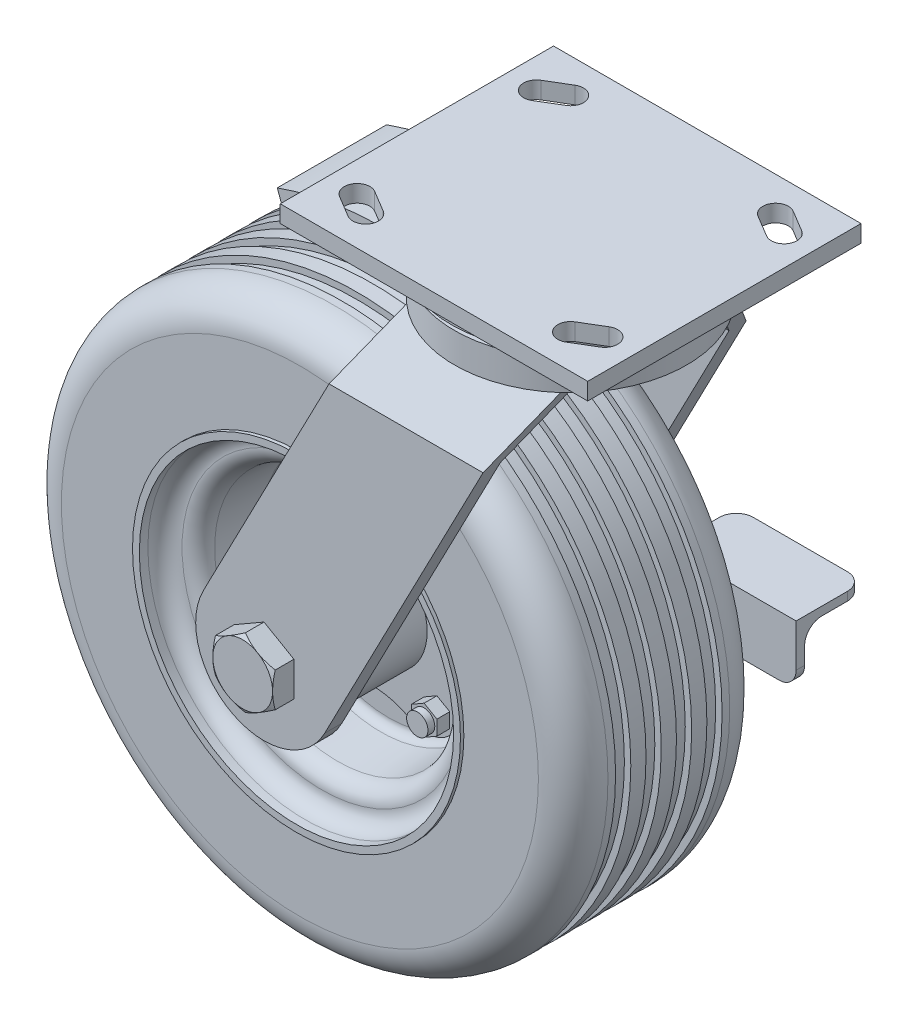
from build123d import *

# Parameters (mm, degrees)
SKETCH1_W               = 114.29999999999998
SKETCH1_H               = 6.349999999999999
BOSS_EXTRUDE1_DEPTH     = 50.8
F_1_2_HOLES_DEPTH       = 77.72734193232553
BOSS_EXTRUDE5_DEPTH     = 6.35
BOSS_EXTRUDE6_DEPTH     = 4.7625
SKETCH15_R              = 3.96874999999999
BOSS_EXTRUDE7_DEPTH     = 2.54
SKETCH16_R              = 6.3500000000000005
SKETCH16_R_2            = 6.349999999999994
BOSS_EXTRUDE8_DEPTH     = 4.7625
SKETCH7_W               = 195.3125047775847
SKETCH7_H               = 97.78999999999996
BOSS_EXTRUDE2_DEPTH     = 226.8474
CUT_EXTRUDE1_START      = -97.79
CUT_EXTRUDE1_DEPTH      = 97.79
CUT_EXTRUDE3_DEPTH      = 227.2515955736278
CUT_EXTRUDE3_DEPTH_BACK = 227.2515955736278
SKETCH9_OUTSIDE_W       = 174.294
SKETCH9_OUTSIDE_H       = 326.69399999999996
BOSS_EXTRUDE3_DEPTH     = 7.9375
SKETCH11_OUTSIDE_W      = 1416.8760000000002
SKETCH11_OUTSIDE_H      = 1447.038
SKETCH11_OUTSIDE_R      = 11.112499999999976
CUT_EXTRUDE4_DEPTH      = 323.3127017548331
CUT_EXTRUDE4_DRAFT      = -60.000000000000135
SKETCH12_R              = 10.794999999999998
BOSS_EXTRUDE4_DEPTH     = 85.09
BOSS_EXTRUDE9_DEPTH     = 3.175
BOSS_EXTRUDE10_DEPTH    = 53.33999999999999
FILLET1_R               = 12.7
FILLET2_R               = 15.875
BOSS_EXTRUDE11_DEPTH    = 40.64
BOSS_EXTRUDE12_DEPTH    = 3.175
SKETCH22_W              = 47.625
SKETCH22_H              = 3.1750000000000114
BOSS_EXTRUDE13_DEPTH    = 22.224999999999998
FILLET3_R               = 6.35
FILLET4_R               = 6.35
BOSS_EXTRUDE14_DEPTH    = 7.619999999999999


# Read off the part's stored shape, not the designer's step: Cut-Extrude1
with BuildPart() as part:
    # Sketch1 → Boss-Extrude1 (new, symmetric)
    with BuildSketch(Plane.XY):
        with Locations((0, -3.1749999999999994)):
            Rectangle(SKETCH1_W, SKETCH1_H)
    extrude(amount=BOSS_EXTRUDE1_DEPTH, both=True)

    # Sketch2 → 1-2 holes (cut, through all)
    with BuildSketch(Plane(origin=(0, 0, 0), x_dir=(1, 0, 0), z_dir=(0, 1, 0))):
        with BuildLine():
            Line((-35.6497139647764, 34.016189941294016), (-43.587213964776424, 29.253689941294038))
            ThreePointArc((-43.587213964776424, 29.253689941294038), (-50.12131005870599, 30.887213964776407), (-48.48778603522359, 37.421310058705984))
            Line((-48.48778603522359, 37.421310058705984), (-40.55028603522361, 42.18381005870601))
            ThreePointArc((-40.55028603522361, 42.18381005870601), (-34.016189941294016, 40.550286035223586), (-35.6497139647764, 34.016189941294016))
        make_face()
        with BuildLine():
            Line((-35.6497139647764, -34.016189941294016), (-43.587213964776424, -29.253689941294038))
            ThreePointArc((-43.587213964776424, -29.253689941294038), (-50.12131005870599, -30.887213964776407), (-48.48778603522359, -37.421310058705984))
            Line((-48.48778603522359, -37.421310058705984), (-40.55028603522361, -42.18381005870601))
            ThreePointArc((-40.55028603522361, -42.18381005870601), (-34.016189941294016, -40.550286035223586), (-35.6497139647764, -34.016189941294016))
        make_face()
        with BuildLine():
            Line((35.6497139647764, 34.016189941294016), (43.587213964776424, 29.253689941294038))
            ThreePointArc((43.587213964776424, 29.253689941294038), (50.12131005870599, 30.887213964776407), (48.48778603522359, 37.421310058705984))
            Line((48.48778603522359, 37.421310058705984), (40.55028603522361, 42.18381005870601))
            ThreePointArc((40.55028603522361, 42.18381005870601), (34.016189941294016, 40.550286035223586), (35.6497139647764, 34.016189941294016))
        make_face()
        with BuildLine():
            Line((35.6497139647764, -34.016189941294016), (43.587213964776424, -29.253689941294038))
            ThreePointArc((43.587213964776424, -29.253689941294038), (50.12131005870599, -30.887213964776407), (48.48778603522359, -37.421310058705984))
            Line((48.48778603522359, -37.421310058705984), (40.55028603522361, -42.18381005870601))
            ThreePointArc((40.55028603522361, -42.18381005870601), (34.016189941294016, -40.550286035223586), (35.6497139647764, -34.016189941294016))
        make_face()
    extrude(amount=-F_1_2_HOLES_DEPTH, mode=Mode.SUBTRACT)


with BuildPart() as body_2:
    # Sketch4 → Revolve1 (revolve)
    with BuildSketch(Plane.XY, mode=Mode.PRIVATE) as revolve1_sk:
        Polygon((2.55e-15, -27.1526), (43.17999999999999, -27.152599999999993), (43.17999999999999, -16.040099999999995), (40.64, -16.0401), (40.64, -13.5001), (44.449999999999996, -13.5001), (44.449999999999996, -6.35), (0, -6.350000000000005), align=None)
    revolve(revolve1_sk.sketch.rotate(Axis((0, -6.350000000000005, 0), (1.2e-16, -1, 0)), 180), axis=Axis((0, -6.350000000000005, 0), (1.2e-16, -1, 0)))


with BuildPart() as body_3:
    # Sketch6 → Revolve2 (revolve)
    with BuildSketch(Plane(origin=(-65.08749999999996, 0, 0), x_dir=(0, 0, -1), z_dir=(1, 0, 0)), mode=Mode.PRIVATE) as revolve2_sk:
        with BuildLine():
            Line((-35.559999999999995, -91.44000000000003), (-35.559999999999995, -63.7309090909091))
            ThreePointArc((-35.559999999999995, -63.7309090909091), (-31.772624414179496, -54.58737558582051), (-22.629090909090905, -50.80000000000001))
            Line((-22.629090909090905, -50.80000000000001), (-19.80045454545454, -50.80000000000001))
            Line((-19.80045454545454, -50.80000000000001), (-19.80045454545454, -53.18125000000001))
            Line((-19.80045454545454, -53.18125000000001), (-14.143181818181809, -53.18125000000001))
            Line((-14.143181818181809, -53.18125000000001), (-14.143181818181809, -50.80000000000001))
            Line((-14.143181818181809, -50.80000000000001), (-8.485909090909075, -50.80000000000001))
            Line((-8.485909090909075, -50.80000000000001), (-8.485909090909075, -53.18125000000001))
            Line((-8.485909090909075, -53.18125000000001), (-2.828636363636346, -53.18125000000001))
            Line((-2.828636363636346, -53.18125000000001), (-2.828636363636346, -50.80000000000001))
            Line((-2.828636363636346, -50.80000000000001), (2.828636363636346, -50.80000000000001))
            Line((2.828636363636346, -50.80000000000001), (2.8286363636363467, -53.18125000000001))
            Line((2.8286363636363467, -53.18125000000001), (8.485909090909075, -53.18125000000001))
            Line((8.485909090909075, -53.18125000000001), (8.485909090909075, -50.80000000000001))
            Line((8.485909090909075, -50.80000000000001), (14.143181818181809, -50.80000000000001))
            Line((14.143181818181809, -50.80000000000001), (14.143181818181809, -53.18125000000001))
            Line((14.143181818181809, -53.18125000000001), (19.80045454545454, -53.181250000000006))
            Line((19.80045454545454, -53.181250000000006), (19.80045454545454, -50.800000000000004))
            Line((19.80045454545454, -50.800000000000004), (22.629090909090905, -50.800000000000004))
            ThreePointArc((22.629090909090905, -50.800000000000004), (31.772624414179504, -54.587375585820496), (35.559999999999995, -63.73090909090909))
            Line((35.559999999999995, -63.73090909090909), (35.56000000000001, -91.44000000000001))
            Line((35.56000000000001, -91.44000000000001), (36.830000000000005, -91.44))
            Line((36.830000000000005, -91.44), (36.830000000000005, -93.97999999999999))
            Line((36.830000000000005, -93.97999999999999), (33.65500000000001, -93.97999999999999))
            ThreePointArc((33.65500000000001, -93.97999999999999), (29.16487193946543, -95.83987193946541), (27.305000000000017, -100.33))
            ThreePointArc((27.305000000000017, -100.33), (25.636711088744306, -104.61999781835944), (21.50843896644765, -106.6558363328826))
            Line((21.50843896644765, -106.6558363328826), (5.438280516776193, -108.06179301829418))
            ThreePointArc((5.438280516776193, -108.06179301829418), (3.374144455627869, -109.07971227555575), (2.5400000000000085, -111.22471118473547))
            Line((2.5400000000000085, -111.22471118473547), (2.540000000000014, -131.76250000000002))
            Line((2.540000000000014, -131.76250000000002), (36.83, -131.76250000000002))
            Line((36.83, -131.76250000000002), (40.004999999999995, -131.76250000000002))
            Line((40.004999999999995, -131.76250000000002), (40.00500000000001, -152.4))
            Line((40.00500000000001, -152.4), (-40.00499999999999, -152.4))
            Line((-40.00499999999999, -152.4), (-40.00499999999999, -131.76250000000002))
            Line((-40.00499999999999, -131.76250000000002), (-36.82999999999999, -131.76250000000002))
            Line((-36.82999999999999, -131.76250000000002), (-2.539999999999994, -131.76250000000002))
            Line((-2.539999999999994, -131.76250000000002), (-2.539999999999993, -111.22471118473547))
            ThreePointArc((-2.539999999999993, -111.22471118473547), (-3.374144455627854, -109.07971227555575), (-5.438280516776179, -108.06179301829418))
            Line((-5.438280516776179, -108.06179301829418), (-21.508438966447635, -106.6558363328826))
            ThreePointArc((-21.508438966447635, -106.6558363328826), (-25.636711088744292, -104.61999781835944), (-27.305000000000003, -100.33))
            ThreePointArc((-27.305000000000003, -100.33), (-29.16487193946542, -95.83987193946543), (-33.654999999999994, -93.98))
            Line((-33.654999999999994, -93.98), (-36.82999999999999, -93.98))
            Line((-36.82999999999999, -93.98), (-36.82999999999999, -91.44000000000001))
            Line((-36.82999999999999, -91.44000000000001), (-35.559999999999995, -91.44000000000003))
        make_face()
    revolve(revolve2_sk.sketch.rotate(Axis((-65.08749999999996, -152.4, 111.1453036524262), (0, 0, -1)), 90), axis=Axis((-65.08749999999996, -152.4, 111.1453036524262), (0, 0, -1)))

    # Sketch13 → Boss-Extrude5 (add)
    with BuildSketch(Plane.XY.offset(2.5399999999999934)):
        with BuildLine():
            ThreePointArc((-96.27931340691063, -138.06208940710718), (-94.20282593858815, -123.28467406141192), (-79.42541059289287, -121.20818659308935))
            ThreePointArc((-79.42541059289287, -121.20818659308935), (-65.08749999999998, -124.91657039491182), (-50.74958940710708, -121.20818659308935))
            ThreePointArc((-50.74958940710708, -121.20818659308935), (-35.97217406141179, -123.28467406141188), (-33.89568659308932, -138.06208940710718))
            ThreePointArc((-33.89568659308932, -138.06208940710718), (-37.60407039491186, -152.4), (-33.89568659308932, -166.73791059289283))
            ThreePointArc((-33.89568659308932, -166.73791059289283), (-35.97217406141181, -181.51532593858815), (-50.74958940710708, -183.59181340691066))
            ThreePointArc((-50.74958940710708, -183.59181340691066), (-65.08749999999999, -179.88342960508822), (-79.42541059289287, -183.5918134069107))
            ThreePointArc((-79.42541059289287, -183.5918134069107), (-94.20282593858819, -181.51532593858812), (-96.27931340691063, -166.7379105928928))
            ThreePointArc((-96.27931340691063, -166.7379105928928), (-92.57092960508812, -152.4), (-96.27931340691063, -138.06208940710718))
        make_face()
    extrude(amount=BOSS_EXTRUDE5_DEPTH)

    # Sketch14 → Boss-Extrude6 (add)
    with BuildSketch(Plane.XY.offset(8.889999999999993)):
        Polygon((-89.36202269130455, -133.62473862272662), (-84.59952269130454, -130.87510796571104), (-84.59952269130454, -125.37584665167986), (-89.3620226913045, -122.62621599466434), (-94.12452269130449, -125.3758466516799), (-94.12452269130449, -130.87510796571104), align=None)
        Polygon((-36.05047730869544, -130.87510796571104), (-40.81297730869539, -133.62473862272662), (-45.57547730869539, -130.87510796571104), (-45.57547730869539, -125.37584665167986), (-40.81297730869543, -122.62621599466434), (-36.05047730869544, -125.3758466516799), align=None)
        Polygon((-40.81297730869539, -171.17526137727342), (-45.57547730869539, -173.92489203428897), (-45.57547730869539, -179.42415334832015), (-40.81297730869543, -182.17378400533568), (-36.05047730869544, -179.42415334832012), (-36.05047730869544, -173.92489203428897), align=None)
        Polygon((-94.12452269130449, -173.92489203428897), (-89.36202269130455, -171.17526137727342), (-84.59952269130454, -173.92489203428897), (-84.59952269130454, -179.42415334832015), (-89.3620226913045, -182.17378400533568), (-94.12452269130449, -179.42415334832012), align=None)
    extrude(amount=BOSS_EXTRUDE6_DEPTH)

    # Sketch15 → Boss-Extrude7 (add)
    with BuildSketch(Plane.XY.offset(13.652499999999995)):
        with Locations((-89.3620226913045, -128.12547730869545)):
            Circle(SKETCH15_R)
        with Locations(Location((-40.81297730869543, -128.12547730869545, 0), (0, 0, 180))):
            Circle(SKETCH15_R)
        with Locations(Location((-89.3620226913045, -176.67452269130456, 0), (0, 0, 180))):
            Circle(SKETCH15_R)
        with Locations((-40.81297730869543, -176.67452269130456)):
            Circle(SKETCH15_R)
    extrude(amount=BOSS_EXTRUDE7_DEPTH)

    # Sketch16 → Boss-Extrude8 (add)
    with BuildSketch(Plane(origin=(0, 0, -2.5400000000000116), x_dir=(-1, 0, 0), z_dir=(0, 0, -1))):
        with Locations(Location((40.81297730869543, -128.12547730869545, 0), (0, 0, 180))):
            Circle(SKETCH16_R)
        with Locations(Location((89.3620226913045, -128.12547730869545, 0), (0, 0, 180))):
            Circle(SKETCH16_R_2)
        with Locations(Location((89.3620226913045, -176.67452269130456, 0), (0, 0, 180))):
            Circle(SKETCH16_R_2)
        with Locations(Location((40.81297730869543, -176.67452269130456, 0), (0, 0, 180))):
            Circle(SKETCH16_R)
    extrude(amount=BOSS_EXTRUDE8_DEPTH)


with BuildPart() as body_4:
    # Sketch7 → Boss-Extrude2 (new body)
    with BuildSketch(Plane.XZ.offset(27.1526)):
        with Locations((-69.03124761120765, 0)):
            Rectangle(SKETCH7_W, SKETCH7_H)
    extrude(amount=BOSS_EXTRUDE2_DEPTH)

    # Cut-Extrude1 outline → Cut-Extrude1 (cut)
    with BuildSketch(Plane.XY.offset(48.89499999999998).offset(CUT_EXTRUDE1_START)):
        with BuildLine():
            Line((28.625004778, -27.1526), (-42.54916315, -164.112530557))
            ThreePointArc((-42.54916315, -164.112530557), (-76.800030557, -174.93833685), (-87.62583685, -140.687469443))
            Line((-87.62583685, -140.687469443), (-28.625004778, -27.1526))
            Line((-28.625004778, -27.1526), (-166.6875, -27.1526))
            Line((-166.6875, -27.1526), (-166.6875, -254))
            Line((-166.6875, -254), (28.625004778, -254))
            Line((28.625004778, -254), (28.625004778, -27.1526))
        make_face()
    extrude(amount=CUT_EXTRUDE1_DEPTH, mode=Mode.SUBTRACT)

    # Sketch9 outside → Cut-Extrude3 (cut, two sides: drawn at the far end of the back side and taken through both)
    with BuildSketch(Plane(origin=(0, -144.30669368869363, 0), x_dir=(0, 0, -1), z_dir=(-1, 0, 0)).offset(-CUT_EXTRUDE3_DEPTH_BACK)):
        with Locations((0, -17.307000000000002)):
            Rectangle(SKETCH9_OUTSIDE_W, SKETCH9_OUTSIDE_H)
        Polygon((48.89499999999998, 109.69330631130639), (48.89500000000001, -93.5066936886937), (32.32833898429133, -117.15409368869362), (25.978338984291256, -117.15409368869362), (42.54500000000001, -93.5066936886936), (42.54500000000001, 109.69330631130639), align=None, mode=Mode.SUBTRACT)
        Polygon((-25.978338984291256, -117.15409368869362), (-32.32833898429133, -117.15409368869362), (-48.89500000000001, -93.50669368869369), (-48.89499999999998, 109.69330631130639), (-42.54500000000001, 109.69330631130639), (-42.54500000000001, -93.5066936886936), align=None, mode=Mode.SUBTRACT)
    extrude(amount=CUT_EXTRUDE3_DEPTH + CUT_EXTRUDE3_DEPTH_BACK, mode=Mode.SUBTRACT)


with BuildPart() as cut_extrude3_piece_1:
    # of the separate pieces the step leaves, piece 1, a body of its own (cut_extrude3_pieces)
    add(body_4.part.solids().sort_by_distance((16.336125747, -50.8, 48.895))[0])



with BuildPart() as cut_extrude3_piece_2:
    # of the separate pieces the step leaves, piece 2, a body of its own (cut_extrude3_pieces)
    add(body_4.part.solids().sort_by_distance((28.625004778, -27.1526, -32.328338984))[0])


with BuildPart() as body_6:
    # Sketch10 → Boss-Extrude3 (new body)
    with BuildSketch(Plane.XY.offset(48.89499999999998)):
        Polygon((-65.08749999999996, -139.5683902672606), (-76.19999999999993, -145.98419513363032), (-76.19999999999993, -158.81580486636972), (-65.08749999999992, -165.23160973273943), (-53.974999999999945, -158.81580486636972), (-53.974999999999945, -145.98419513363035), align=None)
    extrude(amount=BOSS_EXTRUDE3_DEPTH)


with BuildPart() as cut_extrude4_tool:
    # Sketch11 outside → Cut-Extrude4 (with draft: the straight prism first)
    with BuildSketch(Plane.XY.offset(56.83249999999998)):
        with Locations((-54.76900000000006, -127)):
            Rectangle(SKETCH11_OUTSIDE_W, SKETCH11_OUTSIDE_H)
        with Locations((-65.08749999999996, -152.4)):
            Circle(SKETCH11_OUTSIDE_R, mode=Mode.SUBTRACT)
    extrude(amount=-CUT_EXTRUDE4_DEPTH)
    # Cut-Extrude4: the draft: its side faces are tilted about the plane it starts from
    cut_extrude4_sides = [cut_extrude4_tool.faces().sort_by_distance(p)[0] for p in [
        (-54.769, -850.519, -104.823850877),
        (653.669, -127, -104.823850877),
        (-54.769, 596.519, -104.823850877),
        (-763.207, -127, -104.823850877),
        (-76.2, -152.4, -104.823850877),
    ]]
    draft(cut_extrude4_sides, Plane.XY.offset(56.83249999999998), CUT_EXTRUDE4_DRAFT)


with BuildPart() as body_6_1:
    add(body_6.part)

    # Cut-Extrude4: cut by cut_extrude4_tool
    add(cut_extrude4_tool.part, mode=Mode.SUBTRACT)


with BuildPart() as body_7:
    # Mirror1: mirrored copy
    add(body_6_1.part.mirror(Plane.XY))


with BuildPart() as cut_extrude3_piece_1_1:
    add(cut_extrude3_piece_1.part)

    add(cut_extrude3_piece_2.part)  # Boss-Extrude4 merges Cut-Extrude3 piece 2
    # Sketch12 → Boss-Extrude4 (add)
    with BuildSketch(Plane.XY.offset(-42.54500000000001)):
        with Locations(Location((-65.08749999999996, -152.4, 0), (0, 0, 180))):
            Circle(SKETCH12_R)
    extrude(amount=BOSS_EXTRUDE4_DEPTH)

    # Combine1: union body 7, body 6, body 2, part
    add(body_7.part)
    add(body_6_1.part)
    add(body_2.part)
    add(part.part)



with BuildPart() as body_3_2:
    # Sketch17 → Boss-Extrude9 (new body)
    with BuildSketch(Plane(origin=(0, 0, -48.89499999999998), x_dir=(-1, 0, 0), z_dir=(0, 0, -1))):
        with BuildLine():
            Line((45.889107953687684, -82.41065730829735), (62.00170464956272, -38.141661717600584))
            ThreePointArc((62.00170464956272, -38.141661717600584), (81.49708028361144, -39.28406091573251), (100.51343227956146, -43.72850731620585))
            Line((100.51343227956146, -43.72850731620585), (84.13749999999999, -88.72101147681997))
            Line((84.13749999999999, -88.72101147681997), (84.13749999999997, -177.8))
            Line((84.13749999999997, -177.8), (46.03749999999995, -177.8))
            Line((46.03749999999995, -177.8), (46.03749999999994, -115.89654935460966))
            Line((46.03749999999994, -115.89654935460966), (31.601607953687687, -101.46065730829734))
            Line((31.601607953687687, -101.46065730829734), (31.60160795368768, -82.41065730829735))
            Line((31.60160795368768, -82.41065730829735), (45.889107953687684, -82.41065730829735))
        make_face()
    extrude(amount=BOSS_EXTRUDE9_DEPTH)


with BuildPart() as cut_extrude3_piece_1_2:
    add(cut_extrude3_piece_1_1.part)

    add(body_3_2.part)  # Boss-Extrude10 merges body 3 2
    # Sketch19 → Boss-Extrude10 (add)
    with BuildSketch(Plane.XY.offset(-48.89499999999998)):
        with BuildLine():
            Line((-99.4268747660764, -46.71379954944473), (-100.51343227956144, -43.72850731620585))
            ThreePointArc((-100.51343227956144, -43.72850731620585), (-81.49708028361142, -39.28406091573251), (-62.00170464956272, -38.141661717600584))
            Line((-62.00170464956272, -38.141661717600584), (-60.83158930295544, -41.356527210561445))
            ThreePointArc((-60.83158930295544, -41.356527210561445), (-80.36587669146903, -42.33030920969399), (-99.4268747660764, -46.71379954944473))
        make_face()
    extrude(amount=BOSS_EXTRUDE10_DEPTH)

    # Fillet1
    fillet1_edges = [cut_extrude3_piece_1_2.edges().sort_by_distance(p)[0] for p in [
        (-80.36587669146901, -42.330309209693965, -48.89499999999998),
    ]]
    fillet(fillet1_edges, radius=FILLET1_R)

    # Fillet2
    fillet2_edges = [cut_extrude3_piece_1_2.edges().sort_by_distance(p)[0] for p in [
        (-81.49708028361144, -39.284060915732525, -52.06999999999998),
    ]]
    fillet(fillet2_edges, radius=FILLET2_R)

    # Sketch20 → Boss-Extrude11 (add)
    with BuildSketch(Plane.XY.offset(4.445000000000012)):
        with BuildLine():
            Line((-104.60466116378475, -41.77102730949971), (-101.34685575421949, -50.72177410925708))
            ThreePointArc((-101.34685575421949, -50.72177410925708), (-79.08498257045834, -45.361348188190874), (-56.19330549028202, -44.81702828038584))
            Line((-56.19330549028202, -44.81702828038584), (-59.74954574150308, -35.046338492000196))
            ThreePointArc((-59.74954574150308, -35.046338492000196), (-82.50473014981628, -36.22334262465489), (-104.60466116378475, -41.77102730949971))
        make_face()
    extrude(amount=-BOSS_EXTRUDE11_DEPTH)

    # Sketch21 → Boss-Extrude12 (add)
    with BuildSketch(Plane(origin=(0, 0, -52.06999999999998), x_dir=(-1, 0, 0), z_dir=(0, 0, -1))):
        with BuildLine():
            Line((-31.750000000000036, -141.28750000000002), (43.66860078108584, -141.28750000000002))
            ThreePointArc((43.66860078108584, -141.28750000000002), (65.08749999999996, -128.27), (86.5063992189141, -141.28750000000002))
            Line((86.5063992189141, -141.28750000000002), (161.92499999999995, -141.28750000000002))
            Line((161.92499999999995, -141.28750000000002), (161.92499999999998, -163.51250000000002))
            Line((161.92499999999998, -163.51250000000002), (86.5063992189141, -163.51250000000002))
            ThreePointArc((86.5063992189141, -163.51250000000002), (65.08749999999996, -176.53), (43.66860078108584, -163.51250000000002))
            Line((43.66860078108584, -163.51250000000002), (-31.750000000000036, -163.51250000000002))
            Line((-31.750000000000036, -163.51250000000002), (-31.750000000000036, -141.28750000000002))
        make_face()
    extrude(amount=BOSS_EXTRUDE12_DEPTH)

    # Sketch22 → Boss-Extrude13 (add)
    with BuildSketch(Plane(origin=(0, 0, -55.244999999999976), x_dir=(-1, 0, 0), z_dir=(0, 0, -1))):
        with Locations((-7.937500000000034, -142.87500000000003)):
            Rectangle(SKETCH22_W, SKETCH22_H)
        Polygon((161.92499999999995, -141.28750000000002), (114.29999999999993, -141.28750000000002), (114.29999999999993, -144.46250000000006), (161.92499999999993, -144.46250000000003), align=None)
    extrude(amount=BOSS_EXTRUDE13_DEPTH)

    # Fillet3
    fillet3_edges = [cut_extrude3_piece_1_2.edges().sort_by_distance(p)[0] for p in [
        (7.937500000000034, -144.46250000000003, -55.244999999999976),
        (-138.11249999999993, -144.46250000000003, -55.244999999999976),
    ]]
    fillet(fillet3_edges, radius=FILLET3_R)

    # Fillet4
    fillet4_edges = [cut_extrude3_piece_1_2.edges().sort_by_distance(p)[0] for p in [
        (31.750000000000036, -163.51250000000002, -53.65749999999998),
        (-161.92499999999998, -163.51250000000002, -53.65749999999998),
        (31.750000000000036, -142.87500000000003, -77.46999999999997),
        (-15.874999999999966, -142.87500000000003, -77.46999999999997),
        (-161.92499999999995, -142.87500000000003, -77.46999999999997),
        (-114.29999999999993, -142.87500000000006, -77.46999999999997),
    ]]
    fillet(fillet4_edges, radius=FILLET4_R)

    # Sketch23 → Boss-Extrude14 (add)
    with BuildSketch(Plane(origin=(0, 0, -55.244999999999976), x_dir=(-1, 0, 0), z_dir=(0, 0, -1))):
        Polygon((53.974999999999945, -145.98419513363035), (53.974999999999945, -158.81580486636972), (65.08749999999999, -165.23160973273946), (76.20000000000002, -158.81580486636972), (76.2, -145.9841951336303), (65.08750000000002, -139.56839026726058), align=None)
    extrude(amount=BOSS_EXTRUDE14_DEPTH)


solid = Compound([body_3.part, cut_extrude3_piece_1_2.part])
